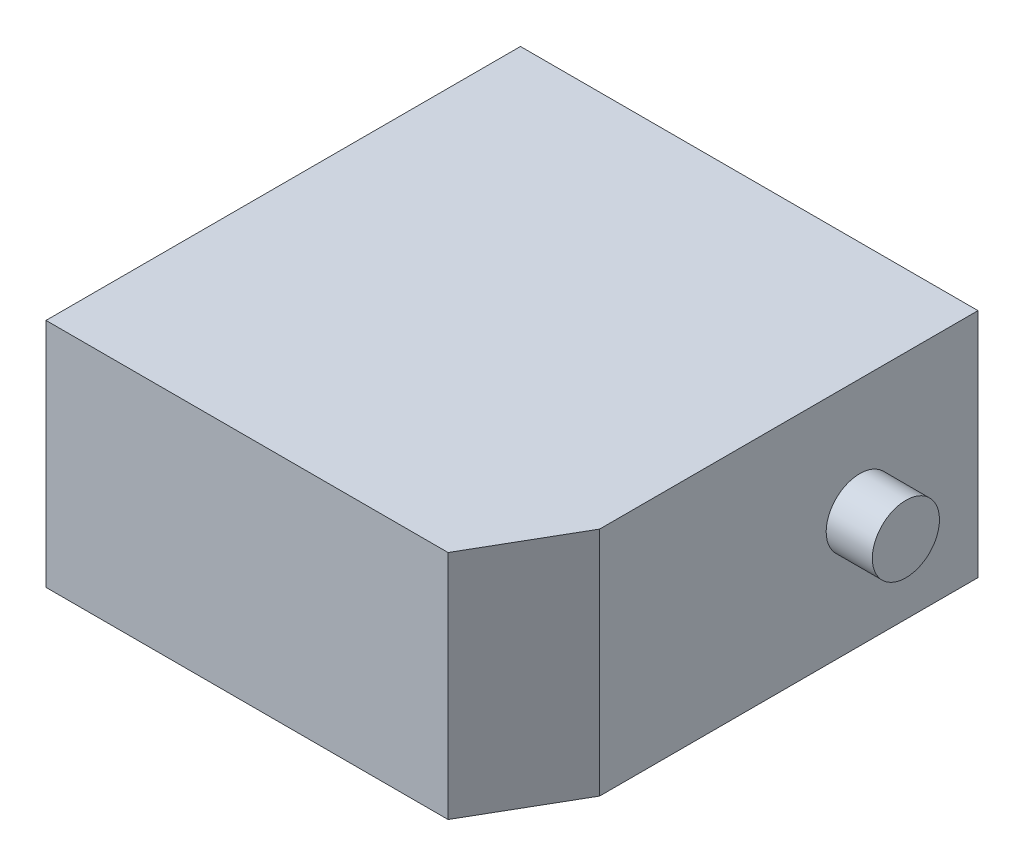
from build123d import *

# Parameters (mm, degrees)
BOSS_EXTRUDE1_DEPTH = 20.1168
SKETCH2_R           = 2.921
BOSS_EXTRUDE2_DEPTH = 4.0132


with BuildPart() as part:
    # Sketch1 → Boss-Extrude1 (new body)
    with BuildSketch(Plane(origin=(0, 0, 0), x_dir=(1, 0, 0), z_dir=(0, 1, 0))):
        Polygon((19.9009, -12.278622803), (15.0749, -20.6375), (-19.9009, -20.6375), (-19.9009, 20.6375), (19.9009, 20.6375), align=None)
    extrude(amount=BOSS_EXTRUDE1_DEPTH)

    # Sketch2 → Boss-Extrude2 (add)
    with BuildSketch(Plane(origin=(19.9009, 0, 0), x_dir=(0, 0, -1), z_dir=(1, 0, 0))):
        with Locations((10.3505, 10.0584)):
            Circle(SKETCH2_R)
    extrude(amount=BOSS_EXTRUDE2_DEPTH)


solid = part.part
